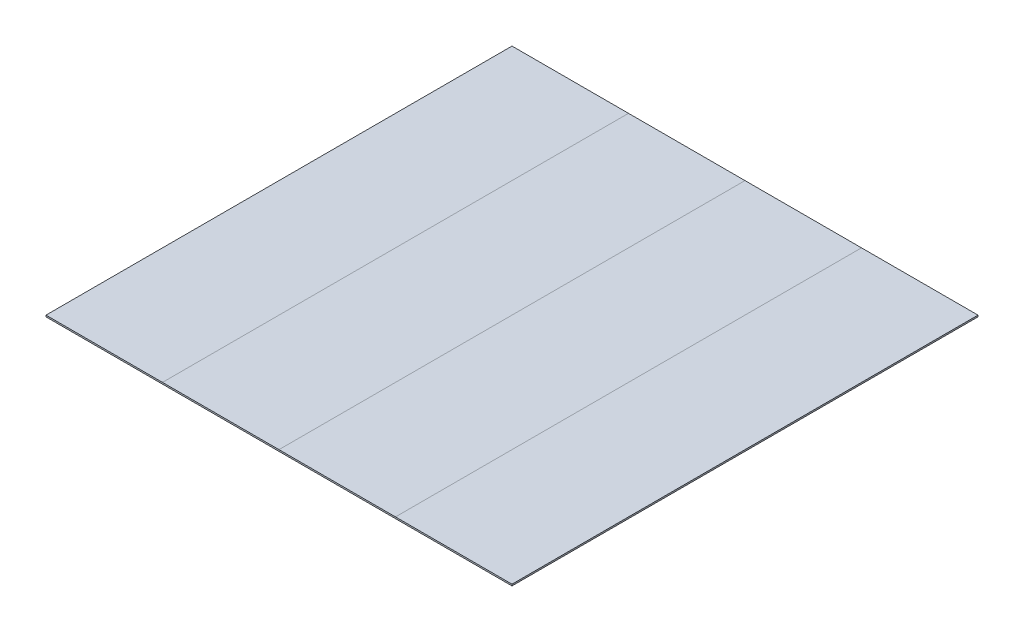
from build123d import *

# Parameters (mm, degrees)
SKETCH8_W            = 1500
SKETCH8_H            = 1500
BOSS_EXTRUDE18_DEPTH = 5


with BuildPart() as part:
    # Sketch8 → Boss-Extrude18 (new body)
    with BuildSketch(Plane(origin=(0, 0, 0), x_dir=(1, 0, 0), z_dir=(0, 1, 0))):
        with Locations((453.438395415, 309.455587393)):
            Rectangle(SKETCH8_W, SKETCH8_H)
    extrude(amount=BOSS_EXTRUDE18_DEPTH)


solid = part.part
